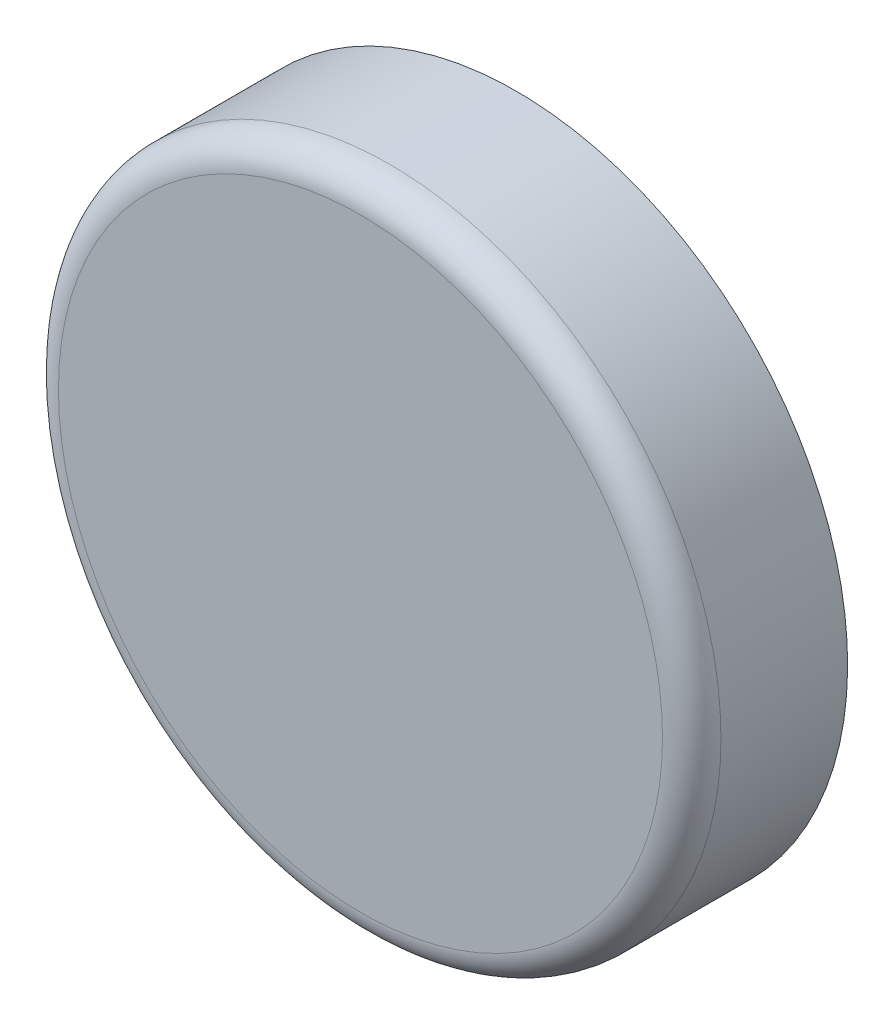
from build123d import *

# Parameters (mm, degrees)
SKETCH1_R           = 34
SKETCH1_R_2         = 32.5
BOSS_EXTRUDE1_DEPTH = 13
SKETCH2_R           = 34
BOSS_EXTRUDE2_DEPTH = 3
FILLET1_R           = 3
SKETCH3_R           = 2.5
SKETCH3_R_2         = 1.5
BOSS_EXTRUDE3_DEPTH = 10
SKETCH4_W           = 15
SKETCH4_H           = 11.580036635
CUT_EXTRUDE1_DEPTH  = 17
BOSS_EXTRUDE4_DEPTH = 13
CUT_EXTRUDE2_REACH  = 78.96
SKETCH5_R           = 1.25


with BuildPart() as part:
    # Sketch1 → Boss-Extrude1 (new body)
    with BuildSketch(Plane.XY):
        Circle(SKETCH1_R)
        Circle(SKETCH1_R_2, mode=Mode.SUBTRACT)
    extrude(amount=BOSS_EXTRUDE1_DEPTH)

    # Sketch2 → Boss-Extrude2 (add)
    with BuildSketch(Plane.XY.offset(13)):
        Circle(SKETCH2_R)
    extrude(amount=BOSS_EXTRUDE2_DEPTH)

    # Fillet1
    fillet1_edges = [part.edges().sort_by_distance(p)[0] for p in [
        (-34, 0, 16),
    ]]
    fillet(fillet1_edges, radius=FILLET1_R)

    # Sketch3 → Boss-Extrude3 (add)
    # profile 1 of 2: a face of its own
    with BuildSketch(Plane(origin=(0, 0, 13), x_dir=(-1, 0, 0), z_dir=(0, 0, -1))):
        with Locations((-20, 0)):
            Circle(SKETCH3_R)
        with Locations((-20, 0)):
            Circle(SKETCH3_R_2, mode=Mode.SUBTRACT)
    # profile 2 of 2: a face of its own
    with BuildSketch(Plane(origin=(0, 0, 13), x_dir=(-1, 0, 0), z_dir=(0, 0, -1))):
        with Locations((20, 0)):
            Circle(SKETCH3_R)
        with Locations((20, 0)):
            Circle(SKETCH3_R_2, mode=Mode.SUBTRACT)
    extrude(amount=BOSS_EXTRUDE3_DEPTH)

    # Sketch4 → Cut-Extrude1 (cut)
    with BuildSketch(Plane(origin=(0, 0, 0), x_dir=(-1, 0, 0), z_dir=(0, 0, -1))):
        with Locations((0, -38.952497116)):
            Rectangle(SKETCH4_W, SKETCH4_H)
    extrude(amount=-CUT_EXTRUDE1_DEPTH, mode=Mode.SUBTRACT)

    # Sketch6 → Boss-Extrude4 (add)
    with BuildSketch(Plane(origin=(0, 0, 0), x_dir=(-1, 0, 0), z_dir=(0, 0, -1))):
        Polygon((-9.227671168, -31.162478798), (9.227671168, -31.162478798), (7.5, -33.162478798), (-7.5, -33.162478798), align=None)
    extrude(amount=-BOSS_EXTRUDE4_DEPTH)

    # Sketch5 → Cut-Extrude2 (cut, up to next)
    with BuildSketch(Plane.XZ.offset(33.162478798), mode=Mode.PRIVATE) as cut_extrude2_sk1:
        with Locations((-6.5, 5.06819686)):
            Circle(SKETCH5_R)
    cut_extrude2_tool1 = extrude(cut_extrude2_sk1.sketch, amount=-CUT_EXTRUDE2_REACH, mode=Mode.PRIVATE) & part.part
    # Sketch5 → Cut-Extrude2 (cut, up to next)
    with BuildSketch(Plane.XZ.offset(33.162478798), mode=Mode.PRIVATE) as cut_extrude2_sk2:
        with Locations((6.5, 5.06819686)):
            Circle(SKETCH5_R)
    cut_extrude2_tool2 = extrude(cut_extrude2_sk2.sketch, amount=-CUT_EXTRUDE2_REACH, mode=Mode.PRIVATE) & part.part
    add(cut_extrude2_tool1.solids().sort_by_distance((-6.5, -33.162479, 5.068197))[0], mode=Mode.SUBTRACT)
    add(cut_extrude2_tool2.solids().sort_by_distance((6.5, -33.162479, 5.068197))[0], mode=Mode.SUBTRACT)


solid = part.part
